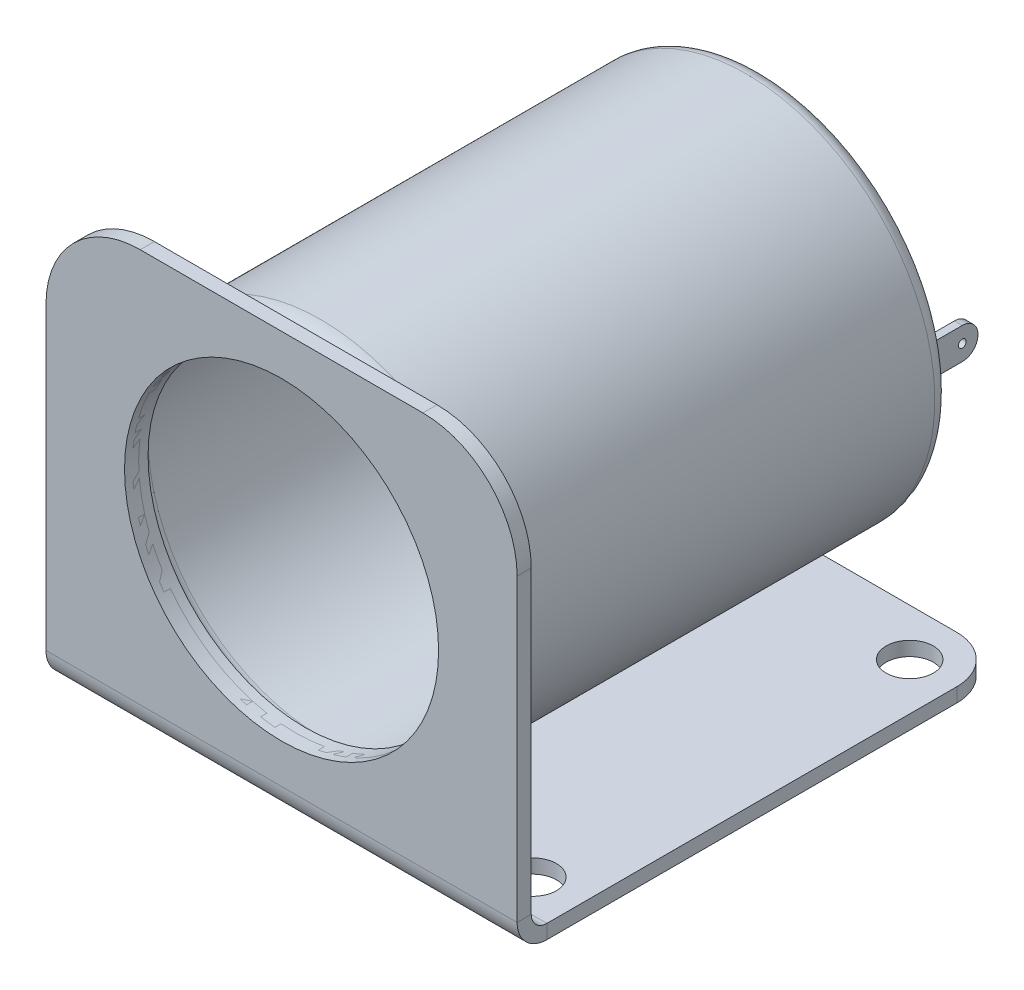
from build123d import *

# Parameters (mm, degrees)
SKETCH6_R                         = 12
EXTRUDE5_DEPTH                    = 30.1
FILLET1_R                         = 2
FILLET3_R                         = 1
BASE_FLANGE2_DEPTH                = 15
SKETCH10_R                        = 4.25
EXTRUDE8_DEPTH                    = 2
FILLET4_R                         = 0.3
SKETCH15_W                        = 1.5
SKETCH15_H                        = 0.9
F_3_0_3_DIAMETER_HOLE1_AT_2_COUNT = 2
F_3_0_3_DIAMETER_HOLE1_AT_2_PITCH = 33.941125497
F_3_0_3_DIAMETER_HOLE1_AT_3_COUNT = 2
F_3_0_3_DIAMETER_HOLE1_AT_3_PITCH = 24
F_3_0_3_DIAMETER_HOLE1_AT_4_COUNT = 2
F_3_0_3_DIAMETER_HOLE1_AT_4_PITCH = 24
FILLET6_R                         = 6
FILLET7_R                         = 3
SKETCH16_W                        = 0.5
SKETCH16_H                        = 2
EXTRUDE10_DEPTH                   = 4
FILLET8_RADIUS                    = 1
FILLET8_LENGTH                    = 0.5
FILLET9_RADIUS                    = 1
FILLET9_LENGTH                    = 0.5
SKETCH17_R                        = 0.25
EXTRUDE11_DEPTH                   = 74.046303808
SKETCH19_R                        = 1.55
EXTRUDE13_DEPTH                   = 39.666781609
SKETCH21_R                        = 10
EXTRUDE14_DEPTH                   = 0.9


# Read off the part's stored shape, not the designer's step: Shell4
# Sheet-metal steps are written as plain solids
with BuildPart() as part:
    # Sketch6 → Extrude5 (new body)
    with BuildSketch(Plane(origin=(0, 0, -33.1), x_dir=(-1, 0, 0), z_dir=(0, 0, -1))):
        Circle(SKETCH6_R)
    extrude(amount=EXTRUDE5_DEPTH)

    # Fillet1
    fillet1_edges = [part.edges().sort_by_distance(p)[0] for p in [
        (12, 0, -33.1),
    ]]
    fillet(fillet1_edges, radius=FILLET1_R)

    # Fillet3
    fillet3_edges = [part.edges().sort_by_distance(p)[0] for p in [
        (12, 0, -63.2),
    ]]
    fillet(fillet3_edges, radius=FILLET3_R)

    # Shell4 outline → Shell4 (revolve, cut)
    with BuildSketch(Plane.XZ):
        with BuildLine():
            Line((10, -34.1), (10, -33.1))
            Line((10, -33.1), (0, -33.1))
            Line((0, -33.1), (0, -62.2))
            Line((0, -62.2), (11, -62.2))
            Line((11, -62.2), (11, -35.1))
            ThreePointArc((11, -35.1), (10.707106781, -34.392893219), (10, -34.1))
        make_face()
    revolve(axis=Axis((0, 0, 0), (0, 0, 1)), mode=Mode.SUBTRACT)

    # Sketch10 → Extrude8 (add)
    with BuildSketch(Plane(origin=(0, 0, -63.2), x_dir=(-1, 0, 0), z_dir=(0, 0, -1))):
        Circle(SKETCH10_R)
    extrude(amount=EXTRUDE8_DEPTH)

    # Fillet4
    fillet4_edges = [part.edges().sort_by_distance(p)[0] for p in [
        (4.25, 0, -65.2),
    ]]
    fillet(fillet4_edges, radius=FILLET4_R)

    # Sketch16 → Extrude10 (add)
    with BuildSketch(Plane(origin=(0, 0, -63.2), x_dir=(-1, 0, 0), z_dir=(0, 0, -1))):
        with Locations((-9.5, 0)):
            Rectangle(SKETCH16_W, SKETCH16_H)
        with Locations((9.5, 0)):
            Rectangle(SKETCH16_W, SKETCH16_H)
    extrude(amount=EXTRUDE10_DEPTH)

    # Fillet8: full round fillet: the end face becomes a half cylinder, R = half its width
    fillet8_face = Plane((9.5, 0, -67.2), x_dir=(-1, 0, 0), z_dir=(0, 0, -1))  # on the end face: x along it, z out of the body
    fillet8_slab = fillet8_face.offset(-FILLET8_RADIUS / 2) * Box(FILLET8_LENGTH, 2 * FILLET8_RADIUS, FILLET8_RADIUS, mode=Mode.PRIVATE)  # the body's end, R deep
    fillet8_round = Plane((9.5, 0, -66.2), x_dir=(0, 0, -1), z_dir=(-1, 0, 0)) * Cylinder(FILLET8_RADIUS, FILLET8_LENGTH, mode=Mode.PRIVATE)  # its axis R under the face
    add(fillet8_slab - fillet8_round, mode=Mode.SUBTRACT)

    # Fillet9: full round fillet: the end face becomes a half cylinder, R = half its width
    fillet9_face = Plane((-9.5, 0, -67.2), x_dir=(-1, 0, 0), z_dir=(0, 0, -1))  # on the end face: x along it, z out of the body
    fillet9_slab = fillet9_face.offset(-FILLET9_RADIUS / 2) * Box(FILLET9_LENGTH, 2 * FILLET9_RADIUS, FILLET9_RADIUS, mode=Mode.PRIVATE)  # the body's end, R deep
    fillet9_round = Plane((-9.5, 0, -66.2), x_dir=(0, 0, -1), z_dir=(-1, 0, 0)) * Cylinder(FILLET9_RADIUS, FILLET9_LENGTH, mode=Mode.PRIVATE)  # its axis R under the face
    add(fillet9_slab - fillet9_round, mode=Mode.SUBTRACT)

    # Sketch17 → Extrude11 (cut, through all)
    with BuildSketch(Plane.ZY.offset(9.75)):
        with Locations((-66.2, 0)):
            Circle(SKETCH17_R)
    extrude(amount=-EXTRUDE11_DEPTH, mode=Mode.SUBTRACT)


with BuildPart() as body_2:
    # Sketch4 → Base-Flange2 (new, symmetric)
    with BuildSketch(Plane(origin=(0, 0, 0), x_dir=(0, 0, -1), z_dir=(1, 0, 0))):
        with BuildLine():
            Line((33.5, 12.6), (33.5, -12.5))
            ThreePointArc((33.5, -12.5), (33.792893219, -13.207106781), (34.5, -13.5))
            Line((34.5, -13.5), (63.6, -13.5))
            Line((63.6, -13.5), (63.6, -14.4))
            Line((63.6, -14.4), (34.5, -14.4))
            ThreePointArc((34.5, -14.4), (33.156497116, -13.843502884), (32.6, -12.5))
            Line((32.6, -12.5), (32.6, 12.6))
            Line((32.6, 12.6), (33.5, 12.6))
        make_face()
    extrude(amount=BASE_FLANGE2_DEPTH, both=True)

    # Sketch15 → Ø3.0 (3) Diameter Hole1 (revolve, cut)
    with BuildSketch(Plane(origin=(12, -14.4, -60.6), x_dir=(0, 0, -1), z_dir=(1, 0, 0))):
        with Locations((0.75, 0.45)):
            Rectangle(SKETCH15_W, SKETCH15_H)
    f_3_0_3_diameter_hole1 = revolve(axis=Axis((12, -20.75, -60.6), (0, 1, 0)), mode=Mode.SUBTRACT)

    # Ø3.0 (3) Diameter Hole1 at 2: Ø3.0 (3) Diameter Hole1 ×2
    with Locations(*[Vector(-0.7071067811865476, 0, 0.7071067811865476) * (i * F_3_0_3_DIAMETER_HOLE1_AT_2_PITCH) for i in range(1, F_3_0_3_DIAMETER_HOLE1_AT_2_COUNT)]):
        add(f_3_0_3_diameter_hole1, mode=Mode.SUBTRACT)

    # Ø3.0 (3) Diameter Hole1 at 3: Ø3.0 (3) Diameter Hole1 ×2
    with Locations(*[(0, 0, i * F_3_0_3_DIAMETER_HOLE1_AT_3_PITCH) for i in range(1, F_3_0_3_DIAMETER_HOLE1_AT_3_COUNT)]):
        add(f_3_0_3_diameter_hole1, mode=Mode.SUBTRACT)

    # Ø3.0 (3) Diameter Hole1 at 4: Ø3.0 (3) Diameter Hole1 ×2
    with Locations(*[(-i * F_3_0_3_DIAMETER_HOLE1_AT_4_PITCH, 0, 0) for i in range(1, F_3_0_3_DIAMETER_HOLE1_AT_4_COUNT)]):
        add(f_3_0_3_diameter_hole1, mode=Mode.SUBTRACT)

    # Fillet6
    fillet6_edges = [body_2.edges().sort_by_distance(p)[0] for p in [
        (15, 12.6, -33.05),
        (-15, 12.6, -33.05),
    ]]
    fillet(fillet6_edges, radius=FILLET6_R)

    # Fillet7
    fillet7_edges = [body_2.edges().sort_by_distance(p)[0] for p in [
        (15, -13.95, -63.6),
        (-15, -13.95, -63.6),
    ]]
    fillet(fillet7_edges, radius=FILLET7_R)


with BuildPart() as extrude13_tool:
    # Sketch19 → Extrude13 (new, through all)
    with BuildSketch(Plane(origin=(0, 0, -65.2), x_dir=(-1, 0, 0), z_dir=(0, 0, -1))):
        Circle(SKETCH19_R)
    extrude(amount=-EXTRUDE13_DEPTH)


with BuildPart() as part_1:
    add(part.part)

    # Extrude13: cut by extrude13_tool
    add(extrude13_tool.part, mode=Mode.SUBTRACT)


with BuildPart() as body_2_1:
    add(body_2.part)

    # Extrude13: cut by extrude13_tool
    add(extrude13_tool.part, mode=Mode.SUBTRACT)

    # Sketch21 → Extrude14 (cut)
    with BuildSketch(Plane.XY.offset(-32.6)):
        Circle(SKETCH21_R)
    extrude(amount=-EXTRUDE14_DEPTH, mode=Mode.SUBTRACT)


solid = Compound([part_1.part, body_2_1.part])
